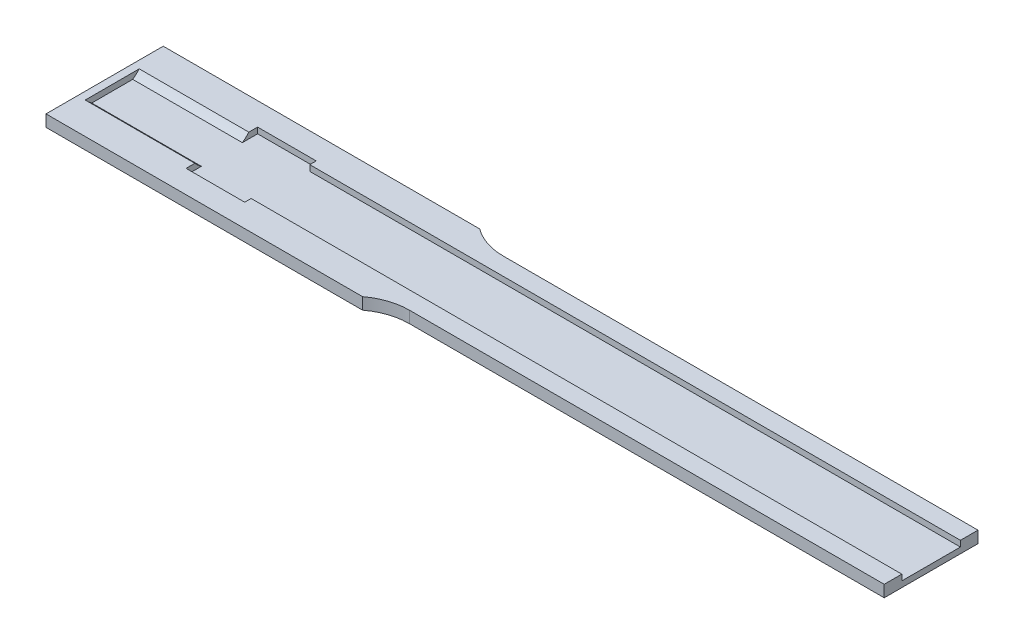
from build123d import *

# Parameters (mm, degrees)
SKETCH1_R               = 2
BOSS_EXTRUDE1_DEPTH     = 4
BOSS_EXTRUDE2_DEPTH     = 6
CUT_EXTRUDE1_START      = -2
CUT_EXTRUDE1_DEPTH      = 18
SKETCH4_W               = 12.2
SKETCH4_H               = 11
CUT_EXTRUDE2_DEPTH      = 10
SKETCH5_W               = 20
SKETCH5_H               = 2
BOSS_EXTRUDE3_DEPTH     = 35
CUT_EXTRUDE4_START      = -0.7
CUT_EXTRUDE4_DEPTH      = 0.7
CUT_EXTRUDE5_DEPTH      = 1
CUT_EXTRUDE6_REACH      = 144.046
SKETCH12_W              = 87
SKETCH12_H              = 2
FILLET1_R               = 10
CUT_EXTRUDE7_DEPTH      = 112.736296699
SKETCH14_W              = 20
SKETCH14_H              = 2
CUT_EXTRUDE8_DEPTH      = 142.58036587
FILLET2_R               = 10
CUT_EXTRUDE9_DEPTH      = 142.58036587
CUT_EXTRUDE9_DEPTH_BACK = 142.58036587
SKETCH15_W              = 20
SKETCH15_H              = 8
CUT_EXTRUDE10_REACH     = 143.58
SKETCH16_W              = 20
SKETCH16_H              = 2


with BuildPart() as part:
    # Sketch1 → Boss-Extrude1 (new, symmetric)
    with BuildSketch(Plane(origin=(0, 0, 0), x_dir=(1, 0, 0), z_dir=(0, 1, 0))):
        with BuildLine():
            ThreePointArc((-4, 7.5), (-11.5, 0), (-4, -7.5))
            Line((-4, -7.5), (0, -7.5))
            Line((0, -7.5), (0, 7.5))
            Line((0, 7.5), (-4, 7.5))
        make_face()
        with Locations(Location((-4, 0, 0), (0, 0, 270))):
            Circle(SKETCH1_R, mode=Mode.SUBTRACT)
    extrude(amount=BOSS_EXTRUDE1_DEPTH, both=True)

    # Sketch1<3> → Boss-Extrude2 (add, symmetric)
    with BuildSketch(Plane(origin=(0, 0, 0), x_dir=(1, 0, 0), z_dir=(0, 1, 0))):
        Polygon((0, 10), (0, 7.5), (0, 0), (141, 0), (141, 10), align=None)
        Polygon((0, 0), (0, -7.5), (0, -10), (141, -10), (141, 0), align=None)
    extrude(amount=BOSS_EXTRUDE2_DEPTH, both=True)

    # Sketch3 → Cut-Extrude1 (cut)
    with BuildSketch(Plane.ZY.offset(CUT_EXTRUDE1_START)):
        with BuildLine():
            Line((-3.494281042, -5), (3.494281042, -5))
            ThreePointArc((3.494281042, -5), (5.4094877, -2.819120931), (6.1, 0))
            Line((6.1, 0), (6.1, 6))
            Line((6.1, 6), (-6.1, 6))
            Line((-6.1, 6), (-6.1, 0))
            ThreePointArc((-6.1, 0), (-5.4094877, -2.819120931), (-3.494281042, -5))
        make_face()
    extrude(amount=-CUT_EXTRUDE1_DEPTH, mode=Mode.SUBTRACT)

    # Sketch4 → Cut-Extrude2 (cut)
    with BuildSketch(Plane.ZY.offset(-20)):
        with Locations((0, 0.5)):
            Rectangle(SKETCH4_W, SKETCH4_H)
    extrude(amount=-CUT_EXTRUDE2_DEPTH, mode=Mode.SUBTRACT)

    # Sketch5 → Boss-Extrude3 (add)
    with BuildSketch(Plane.ZY):
        with Locations((0, -7)):
            Rectangle(SKETCH5_W, SKETCH5_H)
    extrude(amount=-BOSS_EXTRUDE3_DEPTH)

    # Sketch9 → Cut-Extrude4 (cut)
    with BuildSketch(Plane(origin=(2, 0, 0), x_dir=(0, 0, -1), z_dir=(1, 0, 0)).offset(CUT_EXTRUDE4_START)):
        with BuildLine():
            Line((3.494281042, -5), (-3.494281042, -5))
            ThreePointArc((-3.494281042, -5), (-6.1, 0), (-3.494281042, 5))
            Line((-3.494281042, 5), (3.494281042, 5))
            ThreePointArc((3.494281042, 5), (6.1, 0), (3.494281042, -5))
        make_face()
    extrude(amount=CUT_EXTRUDE4_DEPTH, mode=Mode.SUBTRACT)

    # Sketch11 → Cut-Extrude5 (cut, symmetric)
    with BuildSketch(Plane(origin=(0, 0, 0), x_dir=(1, 0, 0), z_dir=(0, 1, 0))):
        with BuildLine():
            Line((2, 1), (2, -1))
            ThreePointArc((2, -1), (0.585786391, -1.585786484), (0, -3.000000131))
            Line((0, -3.000000131), (0, -7.5))
            Line((0, -7.5), (-2, -7.5))
            Line((-2, -7.5), (-2, -3.000000131))
            ThreePointArc((-2, -3.000000131), (-0.828427171, -0.171572922), (2, 1))
        make_face()
    extrude(amount=CUT_EXTRUDE5_DEPTH, both=True, mode=Mode.SUBTRACT)

    # Sketch12 → Cut-Extrude6 (cut, up to next)
    with BuildSketch(Plane(origin=(0, 6, 0), x_dir=(1, 0, 0), z_dir=(0, 1, 0)), mode=Mode.PRIVATE) as cut_extrude6_sk1:
        with Locations((97.5, 9)):
            Rectangle(SKETCH12_W, SKETCH12_H)
    cut_extrude6_tool1 = extrude(cut_extrude6_sk1.sketch, amount=-CUT_EXTRUDE6_REACH, mode=Mode.PRIVATE) & part.part
    # Sketch12 → Cut-Extrude6 (cut, up to next)
    with BuildSketch(Plane(origin=(0, 6, 0), x_dir=(1, 0, 0), z_dir=(0, 1, 0)), mode=Mode.PRIVATE) as cut_extrude6_sk2:
        with Locations((97.5, -9)):
            Rectangle(SKETCH12_W, SKETCH12_H)
    cut_extrude6_tool2 = extrude(cut_extrude6_sk2.sketch, amount=-CUT_EXTRUDE6_REACH, mode=Mode.PRIVATE) & part.part
    add(cut_extrude6_tool1.solids().sort_by_distance((97.5, 6, -9))[0], mode=Mode.SUBTRACT)
    add(cut_extrude6_tool2.solids().sort_by_distance((97.5, 6, 9))[0], mode=Mode.SUBTRACT)

    # Fillet1
    # the kernel refuses this fillet: 10 mm, written as the material it adds along each edge
    with BuildSketch(Plane(origin=(54, 6, 8), x_dir=(0, 0, 1), z_dir=(0, -1, 0))) as fillet1_piece_1:
        with BuildLine():
            CenterArc((10, -6), FILLET1_R, 143.130102354, 36.869897646)
            Line((0, -6), (-0.2, -6))
            Line((-0.2, -6), (-0.2, 0))
            Line((-0.2, 0), (0, 0.2))
            ThreePointArc((0, 0.2), (1, 0.2), (1.84, 0.12))
            Line((1.84, 0.12), (2, 0))
        make_face()
    extrude(amount=12)
    with BuildSketch(Plane(origin=(54, 6, -8), x_dir=(0, 0, -1), z_dir=(0, -1, 0))) as fillet1_piece_2:
        with BuildLine():
            CenterArc((10, 6), FILLET1_R, 180, 36.869897646)
            Line((0, 6), (-0.2, 6))
            Line((-0.2, 6), (-0.2, 0))
            Line((-0.2, 0), (0, -0.2))
            ThreePointArc((0, -0.2), (1, -0.2), (1.84, -0.12))
            Line((1.84, -0.12), (2, 0))
        make_face()
    extrude(amount=12)

    # Sketch13 → Cut-Extrude7 (cut, through all)
    with BuildSketch(Plane.ZY.offset(-30)):
        Polygon((-5, 5), (-5, 1), (-3.5, 1), (-3.5, -1), (-5, -1), (-5, -5), (5, -5), (5, -1), (3.5, -1), (3.5, 1), (5, 1), (5, 5), align=None)
    extrude(amount=-CUT_EXTRUDE7_DEPTH, mode=Mode.SUBTRACT)

    # Sketch14 → Cut-Extrude8 (cut, through all)
    with BuildSketch(Plane.ZY):
        with Locations((0, 5)):
            Rectangle(SKETCH14_W, SKETCH14_H)
    extrude(amount=-CUT_EXTRUDE8_DEPTH, mode=Mode.SUBTRACT)

    # Fillet2
    # the kernel refuses this fillet: 10 mm, written as the material it adds along each edge
    with BuildSketch(Plane(origin=(35, -6, -10), x_dir=(1, 0, 0), z_dir=(0, 0, 1))) as fillet2_piece_1:
        with BuildLine():
            CenterArc((6, -10), FILLET2_R, 90, 36.869897646)
            Line((0, -2), (-0.12, -1.84))
            ThreePointArc((-0.12, -1.84), (-0.2, -1), (-0.2, 0))
            Line((-0.2, 0), (0, 0.2))
            Line((0, 0.2), (6, 0.2))
            Line((6, 0.2), (6, 0))
        make_face()
    extrude(amount=20)

    # Sketch15 → Cut-Extrude9 (cut, two sides: drawn at the far end of the back side and taken through both)
    with BuildSketch(Plane(origin=(0, 0, 0), x_dir=(0, 0, -1), z_dir=(1, 0, 0)).offset(-CUT_EXTRUDE9_DEPTH_BACK)):
        Rectangle(SKETCH15_W, SKETCH15_H)
    extrude(amount=CUT_EXTRUDE9_DEPTH + CUT_EXTRUDE9_DEPTH_BACK, mode=Mode.SUBTRACT)

    # Sketch16 → Cut-Extrude10 (cut, up to next)
    with BuildSketch(Plane(origin=(0, 0, 0), x_dir=(0, 0, -1), z_dir=(1, 0, 0)), mode=Mode.PRIVATE) as cut_extrude10_sk1:
        with Locations((0, -7)):
            Rectangle(SKETCH16_W, SKETCH16_H)
    cut_extrude10_tool1 = extrude(cut_extrude10_sk1.sketch, amount=CUT_EXTRUDE10_REACH, mode=Mode.PRIVATE) & part.part
    add(cut_extrude10_tool1.solids().sort_by_distance((0, -7, 0))[0], mode=Mode.SUBTRACT)


solid = part.part
